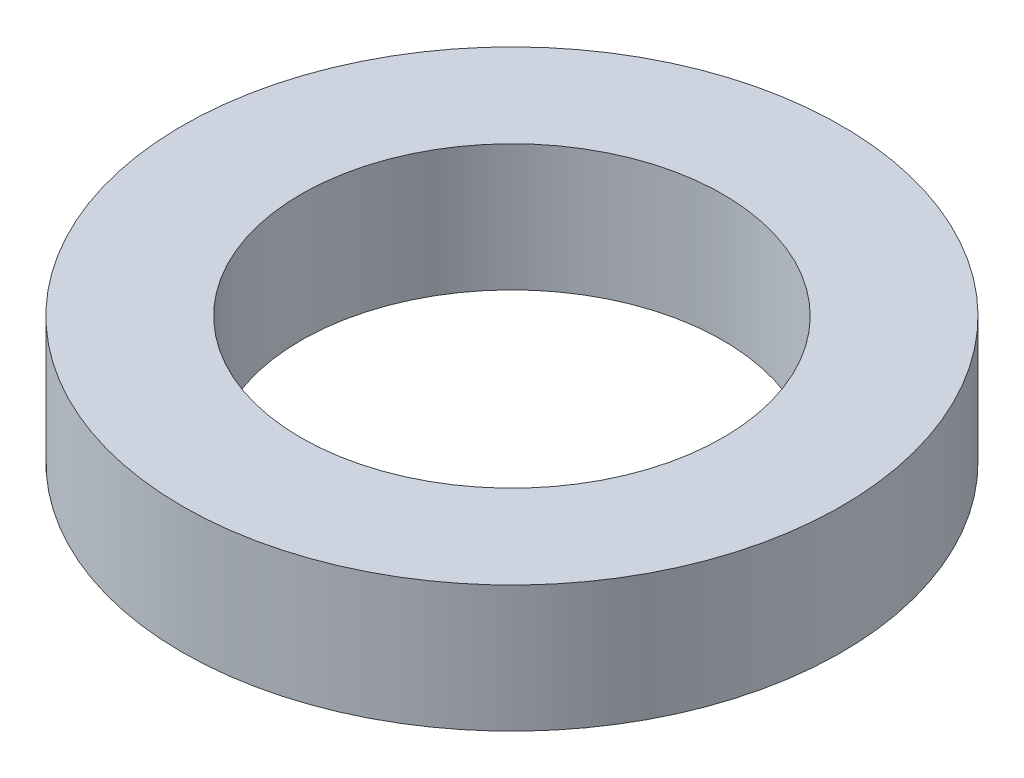
from build123d import *

# Parameters (mm, degrees)
SKETCH1_R           = 62.5
BOSS_EXTRUDE1_DEPTH = 24
SKETCH2_R           = 40
CUT_EXTRUDE1_DEPTH  = 92.588754768


with BuildPart() as part:
    # Sketch1 → Boss-Extrude1 (new body)
    with BuildSketch(Plane(origin=(0, 0, 0), x_dir=(1, 0, 0), z_dir=(0, 1, 0))):
        Circle(SKETCH1_R)
    extrude(amount=BOSS_EXTRUDE1_DEPTH)

    # Sketch2 → Cut-Extrude1 (cut, through all)
    with BuildSketch(Plane(origin=(0, 0, 0), x_dir=(1, 0, 0), z_dir=(0, 1, 0))):
        Circle(SKETCH2_R)
    extrude(amount=CUT_EXTRUDE1_DEPTH, mode=Mode.SUBTRACT)


solid = part.part
